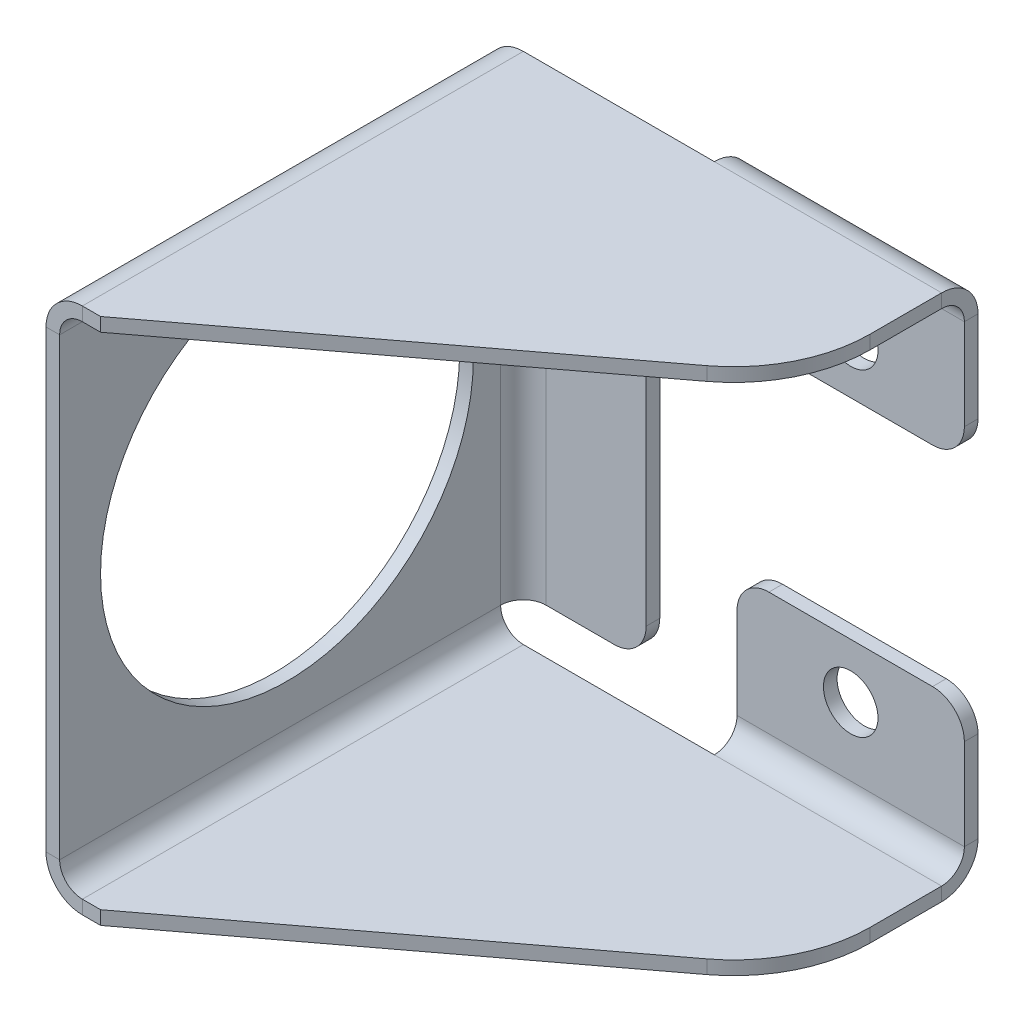
from build123d import *
from build123d.topology import SkipClean

# Parameters (mm, degrees)
SKETCH1_W                    = 100
SKETCH1_H                    = 30
BASE_FLANGE1_DEPTH           = 3
EDGE_FLANGE1_STRIP_W         = 22
EDGE_FLANGE1_STRIP_H         = 3
EDGE_FLANGE1_STRIP_CUT_DEPTH = 100
EDGE_FLANGE1_DEPTH           = 100
EDGE_FLANGE2_DEPTH           = 97
EDGE_FLANGE2_START           = 3
EDGE_FLANGE2_FLAT_DEPTH      = 3
EDGE_FLANGE3_DEPTH           = 50
SKETCH16_R                   = 6
CUT_EXTRUDE1_DEPTH           = 10
SKETCH17_R                   = 41
CUT_EXTRUDE2_DEPTH           = 10
FILLET1_R                    = 7


# Sheet-metal steps are written as plain solids
with BuildPart() as part:
    # Sketch1 → Base-Flange1 (new body)
    with BuildSketch(Plane(origin=(0, 0, 0), x_dir=(0, 1, 0), z_dir=(0, 0, 1))):
        Rectangle(SKETCH1_W, SKETCH1_H)
    extrude(amount=BASE_FLANGE1_DEPTH)

    # Edge-Flange1 strip (across the edge) → Edge-Flange1 strip cut (cut)
    with BuildSketch(Plane(origin=(-15, 50, 3), x_dir=(1, 0, 0), z_dir=(0, -1, 0))):
        with Locations((-3, -1.5)):
            Rectangle(EDGE_FLANGE1_STRIP_W, EDGE_FLANGE1_STRIP_H)
    extrude(amount=EDGE_FLANGE1_STRIP_CUT_DEPTH, mode=Mode.SUBTRACT)

    # Edge-Flange1 section (across the edge) → Edge-Flange1 (add)
    with BuildSketch(Plane(origin=(-15, 50, 3), x_dir=(1, 0, 0), z_dir=(0, -1, 0))):
        with BuildLine():
            Line((0, 5), (0, 102))
            Line((0, 102), (3, 102))
            Line((3, 102), (3, 5))
            ThreePointArc((3, 5), (4.464466094, 1.464466094), (8, 0))
            Line((8, 0), (8, -3))
            ThreePointArc((8, -3), (2.343145751, -0.656854249), (0, 5))
        make_face()
    extrude(amount=EDGE_FLANGE1_DEPTH)

    # Edge-Flange2 bend section (across the edge) → Edge-Flange2 (add)
    with BuildSketch(Plane(origin=(-12, 55, 8), x_dir=(0, -1, 0), z_dir=(0, 0, 1))):
        with BuildLine():
            Line((-3, 5), (0, 5))
            ThreePointArc((0, 5), (1.464466094, 1.464466094), (5, 0))
            Line((5, 0), (5, -3))
            ThreePointArc((5, -3), (-0.656854249, -0.656854249), (-3, 5))
        make_face()
    extrude(amount=EDGE_FLANGE2_DEPTH)

    # Edge-Flange2 profile (on flange) → Edge-Flange2 flat (add)
    with BuildSketch(Plane(origin=(-12, 55, 0), x_dir=(0, 0, 1), z_dir=(0, 1, 0)).offset(EDGE_FLANGE2_START)):
        with BuildLine():
            Line((8, 5), (105, 5))
            Line((105, 5), (105, 9))
            Line((105, 9), (47.688860651, 85.054450695))
            ThreePointArc((47.688860651, 85.054450695), (37.115729743, 93.848030848), (23.729795349, 97))
            Line((23.729795349, 97), (8, 97))
            Line((8, 97), (8, 5))
        make_face()
    extrude(amount=-EDGE_FLANGE2_FLAT_DEPTH)

    # Edge-Flange3 section (across the edge) → Edge-Flange3 (add)
    with BuildSketch(Plane(origin=(35, 55, 3), x_dir=(0, 0, 1), z_dir=(1, 0, 0))):
        with BuildLine():
            Line((-3, 5), (-3, 32))
            Line((-3, 32), (0, 32))
            Line((0, 32), (0, 5))
            ThreePointArc((0, 5), (1.464466094, 1.464466094), (5, 0))
            Line((5, 0), (5, -3))
            ThreePointArc((5, -3), (-0.656854249, -0.656854249), (-3, 5))
        make_face()
    extrude(amount=EDGE_FLANGE3_DEPTH)

    # Sketch16 → Cut-Extrude1 (cut)
    with BuildSketch(Plane.XY.offset(3)):
        with Locations((60, 35)):
            Circle(SKETCH16_R)
    extrude(amount=-CUT_EXTRUDE1_DEPTH, mode=Mode.SUBTRACT)

    # Sketch17 → Cut-Extrude2 (cut)
    with BuildSketch(Plane(origin=(-15, 0, 0), x_dir=(0, -1, 0), z_dir=(-1, 0, 0))):
        with Locations(Location((0, 55, 0), (0, 0, 90))):
            Circle(SKETCH17_R)
    extrude(amount=-CUT_EXTRUDE2_DEPTH, mode=Mode.SUBTRACT)

    # Fillet1
    fillet1_edges = [part.edges().sort_by_distance(p)[0] for p in [
        (15, 50, 1.5),
        (35, 23, 1.5),
        (85, 23, 1.5),
    ]]
    fillet(fillet1_edges, radius=FILLET1_R)

    # SurfaceCut1
    split(bisect_by=Plane(origin=(0, 0, 0), x_dir=(-1, 0, 0), z_dir=(0, 1, 0)), keep=Keep.TOP)

    # Mirror2: part across plane


with BuildPart() as part_1:
    with SkipClean():  # the faces are left unmerged after this step: merging them gives an invalid solid
        add(part.part)
        add(part.part.mirror(Plane.ZX))

    # SurfaceCut2
    split(bisect_by=Plane(origin=(0, 0, 0), x_dir=(-1, 0, 0), z_dir=(0, 1, 0)), keep=Keep.TOP)

    # Mirror3: part across plane


with BuildPart() as part_2:
    with SkipClean():  # the faces are left unmerged after this step: merging them gives an invalid solid
        add(part_1.part)
        add(part_1.part.mirror(Plane.ZX))


solid = part_2.part
